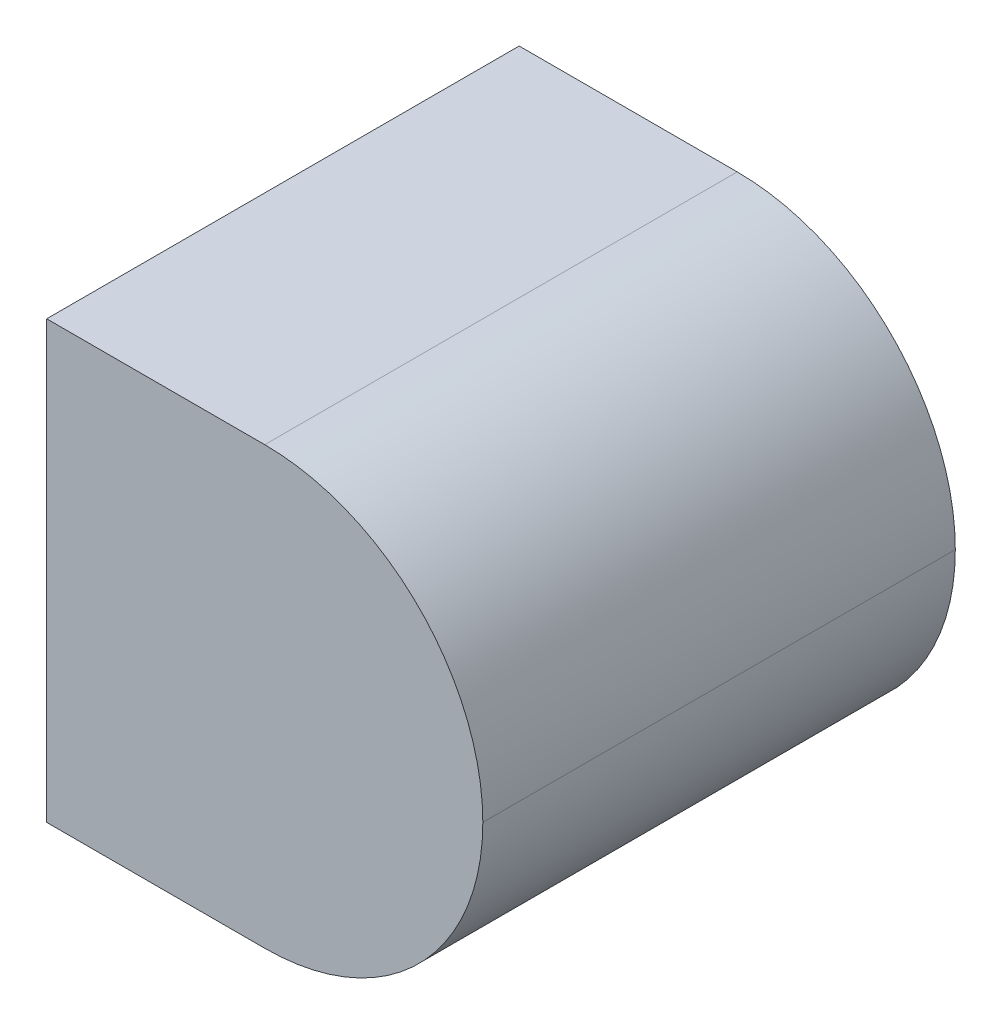
from build123d import *

# Parameters (mm, degrees)
SKETCH1_W           = 6
SKETCH1_H           = 6
BOSS_EXTRUDE1_DEPTH = 6.5
FILLET1_R           = 3
SKETCH2_R           = 1.6
CUT_EXTRUDE1_DEPTH  = 2


with BuildPart() as part:
    # Sketch1 → Boss-Extrude1 (new body)
    with BuildSketch(Plane.XY):
        Rectangle(SKETCH1_W, SKETCH1_H)
    extrude(amount=BOSS_EXTRUDE1_DEPTH)

    # Fillet1
    fillet1_edges = [part.edges().sort_by_distance(p)[0] for p in [
        (3, -3, 3.25),
        (3, 3, 3.25),
    ]]
    fillet(fillet1_edges, radius=FILLET1_R - 0.0001)  # a hair under: the kernel refuses the full size

    # Sketch2 → Cut-Extrude1 (cut)
    with BuildSketch(Plane.ZY.offset(3)):
        with Locations(Location((3.25, 0, 0), (0, 0, 270))):
            Circle(SKETCH2_R)
    extrude(amount=-CUT_EXTRUDE1_DEPTH, mode=Mode.SUBTRACT)


solid = part.part
